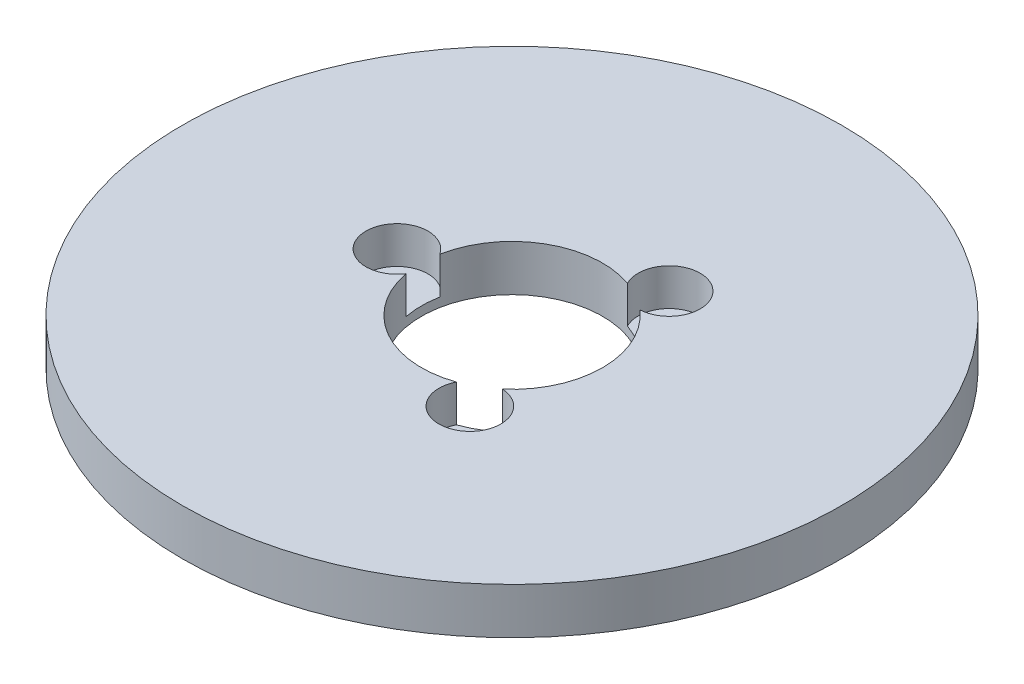
from build123d import *

# Parameters (mm, degrees)
SKETCH1_R           = 100
BOSS_EXTRUDE1_DEPTH = 14
SKETCH2_R           = 27.5
CUT_EXTRUDE1_DEPTH  = 143.112631388
SKETCH3_R           = 9.404556639
CUT_EXTRUDE2_DEPTH  = 11.247996881
CIRPATTERN1_COUNT   = 3


with BuildPart() as part:
    # Sketch1 → Boss-Extrude1 (new body)
    with BuildSketch(Plane(origin=(0, 0, 0), x_dir=(1, 0, 0), z_dir=(0, 1, 0))):
        Circle(SKETCH1_R)
    extrude(amount=BOSS_EXTRUDE1_DEPTH)

    # Sketch2 → Cut-Extrude1 (cut, through all)
    with BuildSketch(Plane(origin=(0, 0, 0), x_dir=(1, 0, 0), z_dir=(0, 1, 0))):
        Circle(SKETCH2_R)
    extrude(amount=CUT_EXTRUDE1_DEPTH, mode=Mode.SUBTRACT)

    # Sketch3 → Cut-Extrude2 (cut)
    with BuildSketch(Plane(origin=(0, 14, 0), x_dir=(1, 0, 0), z_dir=(0, 1, 0))):
        with Locations((-34.913320069, 0)):
            Circle(SKETCH3_R)
    cut_extrude2 = extrude(amount=-CUT_EXTRUDE2_DEPTH, mode=Mode.SUBTRACT)

    # CirPattern1: Cut-Extrude2 ×3 about axis
    cirpattern1_axis = Axis((0, 0, 0), (0, 1, 0))
    for i in range(1, CIRPATTERN1_COUNT):
        add(cut_extrude2.rotate(cirpattern1_axis, i * 360 / CIRPATTERN1_COUNT), mode=Mode.SUBTRACT)


solid = part.part
